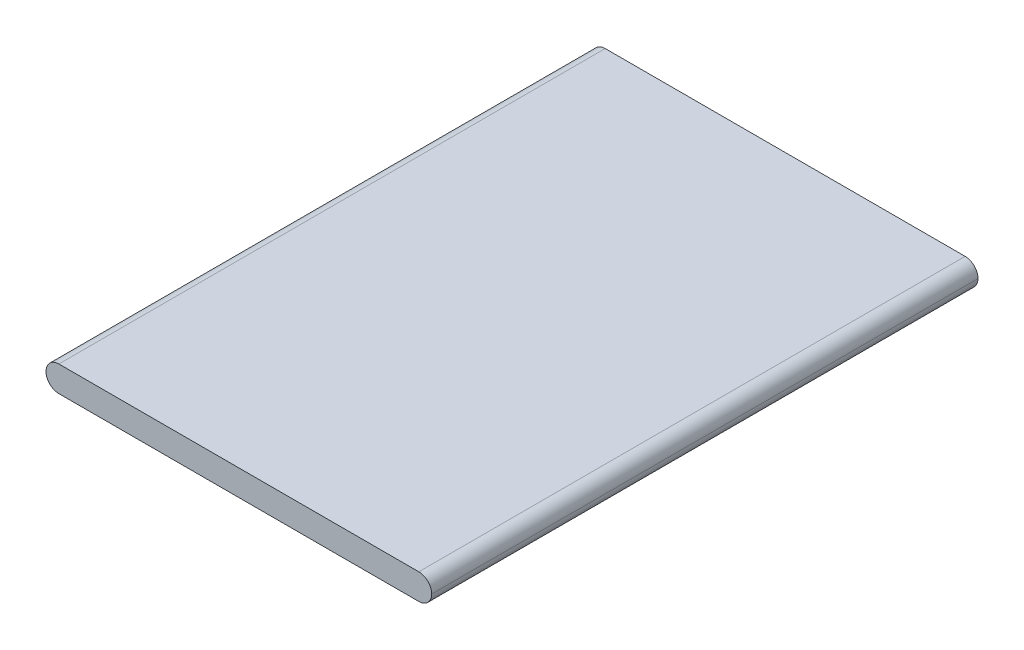
from build123d import *

# Parameters (mm, degrees)
SKETCH2_W           = 60
SKETCH2_H           = 85
BOSS_EXTRUDE1_DEPTH = 4
FILLET1_R           = 2


with BuildPart() as part:
    # Sketch2 → Boss-Extrude1 (new body)
    with BuildSketch(Plane(origin=(0, 0, 0), x_dir=(1, 0, 0), z_dir=(0, 1, 0))):
        Rectangle(SKETCH2_W, SKETCH2_H)
    extrude(amount=BOSS_EXTRUDE1_DEPTH)

    # Fillet1
    fillet1_edges = [part.edges().sort_by_distance(p)[0] for p in [
        (30, 0, 0),
        (-30, 0, 0),
        (-30, 4, 0),
        (30, 4, 0),
    ]]
    fillet(fillet1_edges, radius=FILLET1_R - 0.0001)  # a hair under: the kernel refuses the full size


solid = part.part
